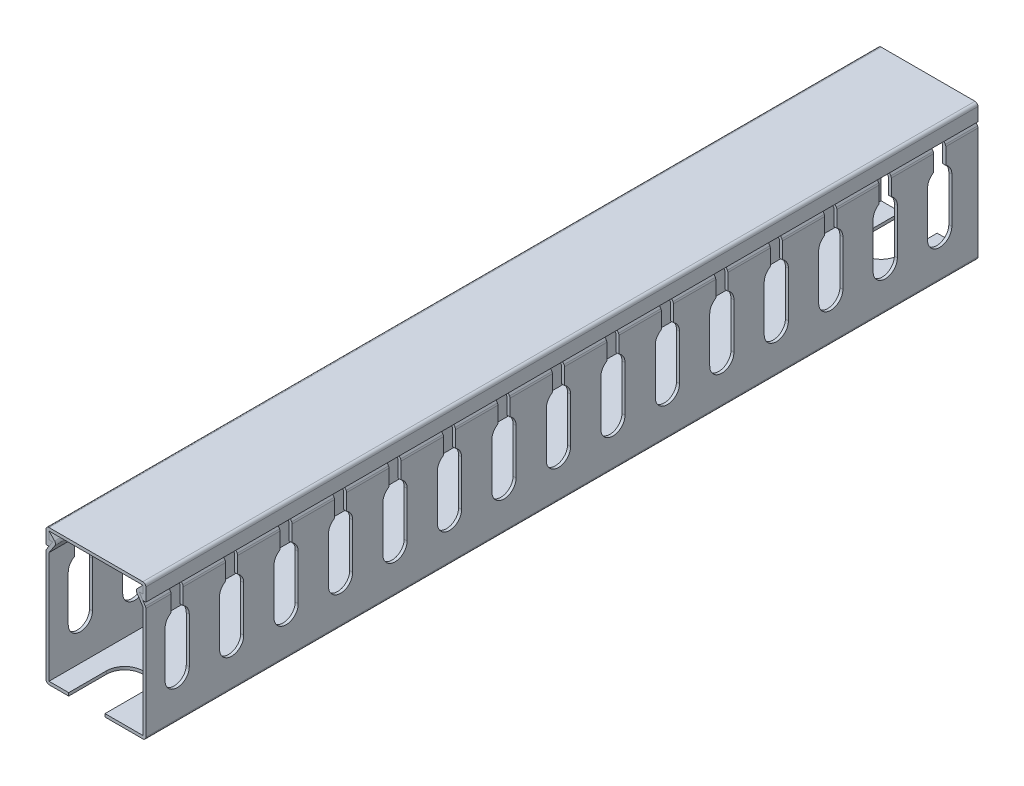
from build123d import *

# Parameters (mm, degrees)
BOSS_EXTRUDE1_DEPTH = 850
BOSS_EXTRUDE2_DEPTH = 850
CUT_EXTRUDE1_DEPTH  = 852.829795206
LPATTERN1_COUNT     = 94
LPATTERN1_PITCH     = 18
SKETCH7_W           = 544.07134957
SKETCH7_H           = 1949.927553928
SKETCH7_W_2         = 100.757731764
SKETCH7_H_2         = 275
CUT_EXTRUDE2_DEPTH  = 398
CUT_EXTRUDE3_DEPTH  = 10
CUT_EXTRUDE4_DEPTH  = 10


with BuildPart() as part:
    # Sketch4 → Boss-Extrude1 (new, symmetric)
    with BuildSketch(Plane.XY):
        with BuildLine():
            Line((-15.5, 1), (-15.5, 37.834592439))
            Line((-15.5, 37.834592439), (-13.524103583, 40.820408077))
            ThreePointArc((-13.524103583, 40.820408077), (-13.36216977, 41.463091663), (-13.637685416, 42.065881742))
            Line((-13.637685416, 42.065881742), (-15.5, 44))
            Line((-15.5, 44), (-15.5, 41.488652376))
            Line((-15.5, 41.488652376), (-14.281021763, 41.488652376))
            Line((-14.281021763, 41.488652376), (-16.333933618, 38.386457205))
            ThreePointArc((-16.333933618, 38.386457205), (-16.457583839, 38.122747242), (-16.5, 37.834592439))
            Line((-16.5, 37.834592439), (-16.5, 1))
            ThreePointArc((-16.5, 1), (-16.207106781, 0.292893219), (-15.5, 0))
            Line((-15.5, 0), (15.5, 0))
            ThreePointArc((15.5, 0), (16.207106781, 0.292893219), (16.5, 1))
            Line((16.5, 1), (16.5, 37.834592439))
            ThreePointArc((16.5, 37.834592439), (16.457583839, 38.122747242), (16.333933618, 38.386457205))
            Line((16.333933618, 38.386457205), (14.281021763, 41.488652376))
            Line((14.281021763, 41.488652376), (15.5, 41.488652376))
            Line((15.5, 41.488652376), (15.5, 44))
            Line((15.5, 44), (13.637685416, 42.065881742))
            ThreePointArc((13.637685416, 42.065881742), (13.36216977, 41.463091663), (13.524103583, 40.820408077))
            Line((13.524103583, 40.820408077), (15.5, 37.834592439))
            Line((15.5, 37.834592439), (15.5, 1))
            Line((15.5, 1), (-15.5, 1))
        make_face()
    extrude(amount=BOSS_EXTRUDE1_DEPTH, both=True)

    # Sketch6 → Cut-Extrude1 (cut, through all)
    with BuildSketch(Plane(origin=(16.5, 0, 0), x_dir=(0, 0, -1), z_dir=(1, 0, 0))):
        with BuildLine():
            Line((-835.65, 29), (-835.65, 14))
            ThreePointArc((-835.65, 14), (-839.65, 10), (-843.65, 14))
            Line((-843.65, 14), (-843.65, 29))
            ThreePointArc((-843.65, 29), (-843.114101615, 31), (-841.65, 32.464101615))
            Line((-841.65, 32.464101615), (-841.65, 44))
            Line((-841.65, 44), (-837.65, 44))
            Line((-837.65, 44), (-837.65, 32.464101615))
            ThreePointArc((-837.65, 32.464101615), (-836.185898385, 31), (-835.65, 29))
        make_face()
    cut_extrude1 = extrude(amount=-CUT_EXTRUDE1_DEPTH, mode=Mode.SUBTRACT)

    # LPattern1: Cut-Extrude1 ×94
    with Locations(*[(0, 0, -i * LPATTERN1_PITCH) for i in range(1, LPATTERN1_COUNT)]):
        add(cut_extrude1, mode=Mode.SUBTRACT)


with BuildPart() as body_2:
    # Sketch5 → Boss-Extrude2 (new, symmetric)
    with BuildSketch(Plane.XY):
        with BuildLine():
            Line((-14.281021763, 41.488652376), (-15.515794777, 39.622762775))
            Line((-15.515794777, 39.622762775), (-16.5, 39.622762775))
            Line((-16.5, 39.622762775), (-16.5, 44))
            ThreePointArc((-16.5, 44), (-16.207106781, 44.707106781), (-15.5, 45))
            Line((-15.5, 45), (15.5, 45))
            ThreePointArc((15.5, 45), (16.207106781, 44.707106781), (16.5, 44))
            Line((16.5, 44), (16.5, 39.622762775))
            Line((16.5, 39.622762775), (15.515794777, 39.622762775))
            Line((15.515794777, 39.622762775), (14.281021763, 41.488652376))
            Line((14.281021763, 41.488652376), (15.5, 41.488652376))
            Line((15.5, 41.488652376), (15.5, 44))
            Line((15.5, 44), (-15.5, 44))
            Line((-15.5, 44), (-15.5, 41.488652376))
            Line((-15.5, 41.488652376), (-14.281021763, 41.488652376))
        make_face()
    extrude(amount=BOSS_EXTRUDE2_DEPTH, both=True)


with BuildPart() as cut_extrude2_tool:
    # Sketch7 → Cut-Extrude2 (new body)
    with BuildSketch(Plane(origin=(0, 45, 0), x_dir=(1, 0, 0), z_dir=(0, 1, 0))):
        with Locations((-146.207810401, 91.754875907)):
            Rectangle(SKETCH7_W, SKETCH7_H)
        with Locations((-2.513420621, -712.5)):
            Rectangle(SKETCH7_W_2, SKETCH7_H_2, mode=Mode.SUBTRACT)
    extrude(amount=-CUT_EXTRUDE2_DEPTH)


with BuildPart() as part_1:
    add(part.part)

    # Cut-Extrude2: cut by cut_extrude2_tool
    add(cut_extrude2_tool.part, mode=Mode.SUBTRACT)

    # Sketch8 → Cut-Extrude3 (cut)
    with BuildSketch(Plane.XZ):
        with BuildLine():
            Line((-9, 837.5), (-9, 850))
            Line((-9, 850), (3, 850))
            Line((3, 850), (3, 837.5))
            ThreePointArc((3, 837.5), (-3, 831.5), (-9, 837.5))
        make_face()
    extrude(amount=-CUT_EXTRUDE3_DEPTH, mode=Mode.SUBTRACT)

    # Sketch9 → Cut-Extrude4 (cut)
    with BuildSketch(Plane.XZ):
        with BuildLine():
            Line((-9, 587.5), (-9, 575))
            Line((-9, 575), (3, 575))
            Line((3, 575), (2.988762488, 587.132952502))
            ThreePointArc((2.988762488, 587.132952502), (-2.816390259, 593.497189964), (-9, 587.5))
        make_face()
    extrude(amount=-CUT_EXTRUDE4_DEPTH, mode=Mode.SUBTRACT)


with BuildPart() as body_2_1:
    add(body_2.part)

    # Cut-Extrude2: cut by cut_extrude2_tool
    add(cut_extrude2_tool.part, mode=Mode.SUBTRACT)


solid = Compound([part_1.part, body_2_1.part])
